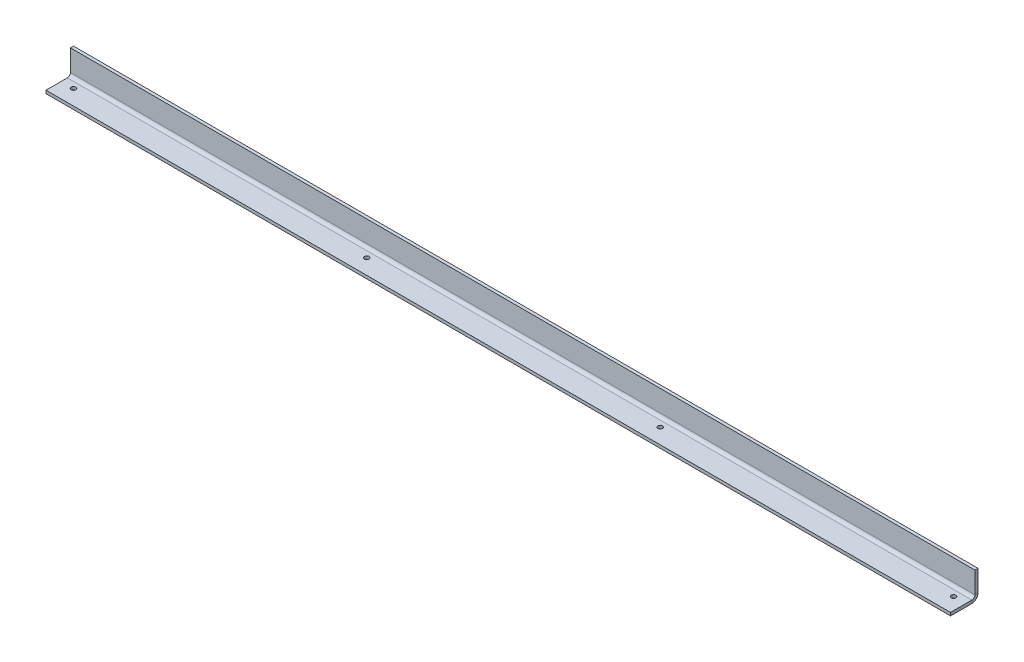
from build123d import *

# Parameters (mm, degrees)
SKETCH1_W                    = 939.8
SKETCH1_H                    = 28.575
BASE_FLANGE1_DEPTH           = 3.175
EDGE_FLANGE1_STRIP_W         = 19.05
EDGE_FLANGE1_STRIP_H         = 3.175
EDGE_FLANGE1_STRIP_CUT_DEPTH = 939.8
EDGE_FLANGE1_DEPTH           = 939.8
F_11_0_191_DIAMETER_HOLE1_D  = 4.8514
LPATTERN1_COUNT              = 4
LPATTERN1_PITCH              = 304.8


# Sheet-metal steps are written as plain solids
with BuildPart() as part:
    # Sketch1 → Base-Flange1 (new body)
    with BuildSketch(Plane(origin=(0, 0, 0), x_dir=(1, 0, 0), z_dir=(0, 1, 0))):
        Rectangle(SKETCH1_W, SKETCH1_H)
    extrude(amount=-BASE_FLANGE1_DEPTH)

    # Edge-Flange1 strip (across the edge) → Edge-Flange1 strip cut (cut)
    with BuildSketch(Plane(origin=(469.9, 0, -14.2875), x_dir=(0, 0, 1), z_dir=(-1, 0, 0))):
        with Locations((-3.175, -1.5875)):
            Rectangle(EDGE_FLANGE1_STRIP_W, EDGE_FLANGE1_STRIP_H)
    extrude(amount=EDGE_FLANGE1_STRIP_CUT_DEPTH, mode=Mode.SUBTRACT)

    # Edge-Flange1 section (across the edge) → Edge-Flange1 (add)
    with BuildSketch(Plane(origin=(469.9, 0, -14.2875), x_dir=(0, 0, 1), z_dir=(-1, 0, 0))):
        with BuildLine():
            Line((0, 3.175), (0, 25.4))
            Line((0, 25.4), (3.175, 25.4))
            Line((3.175, 25.4), (3.175, 3.175))
            ThreePointArc((3.175, 3.175), (4.10493597, 0.92993597), (6.35, 0))
            Line((6.35, 0), (6.35, -3.175))
            ThreePointArc((6.35, -3.175), (1.859871939, -1.315128061), (0, 3.175))
        make_face()
    extrude(amount=EDGE_FLANGE1_DEPTH)

    # #11 (0.191) Diameter Hole1 (through all)
    with Locations(Plane(origin=(0, 0, 0), x_dir=(1, 0, 0), z_dir=(0, 1, 0))):
        with Locations((-457.2, 1.5875)):
            f_11_0_191_diameter_hole1 = Hole(F_11_0_191_DIAMETER_HOLE1_D / 2)

    # LPattern1: #11 (0.191) Diameter Hole1 ×4
    with Locations(*[(i * LPATTERN1_PITCH, 0, 0) for i in range(1, LPATTERN1_COUNT)]):
        add(f_11_0_191_diameter_hole1, mode=Mode.SUBTRACT)


solid = part.part
